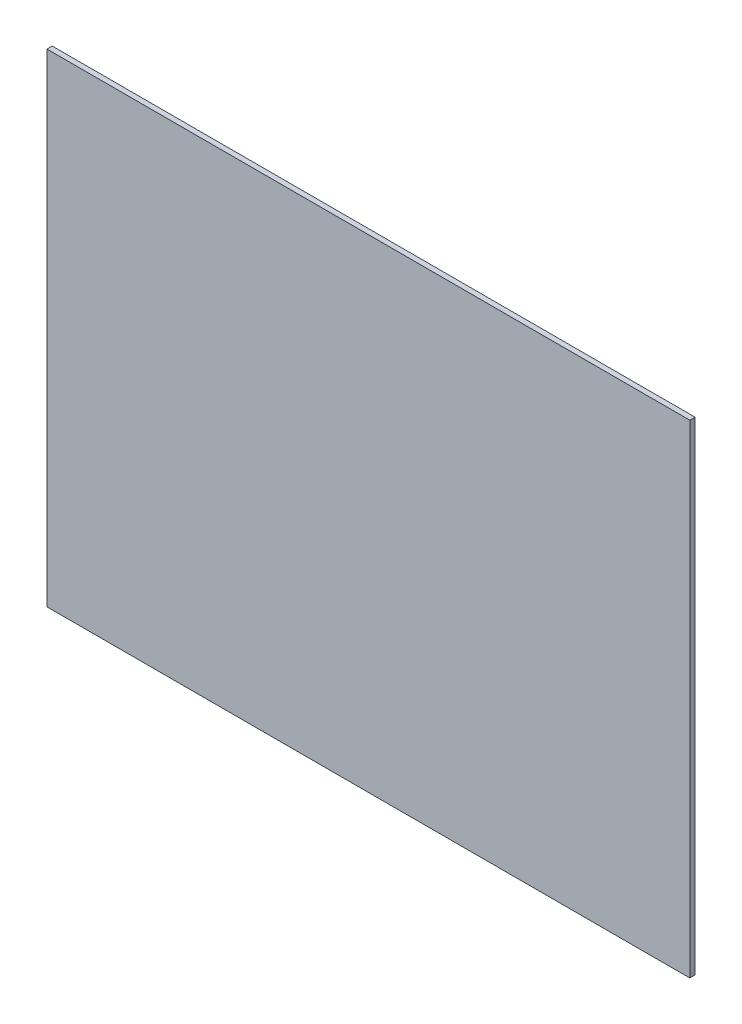
from build123d import *

# Parameters (mm, degrees)
SKETCH1_W      = 490
SKETCH1_H      = 368.2
EXTRUDE1_DEPTH = 4


with BuildPart() as part:
    # Sketch1 → Extrude1 (new body)
    with BuildSketch(Plane.XY):
        with Locations((115, -54.1)):
            Rectangle(SKETCH1_W, SKETCH1_H)
    extrude(amount=EXTRUDE1_DEPTH)


solid = part.part
